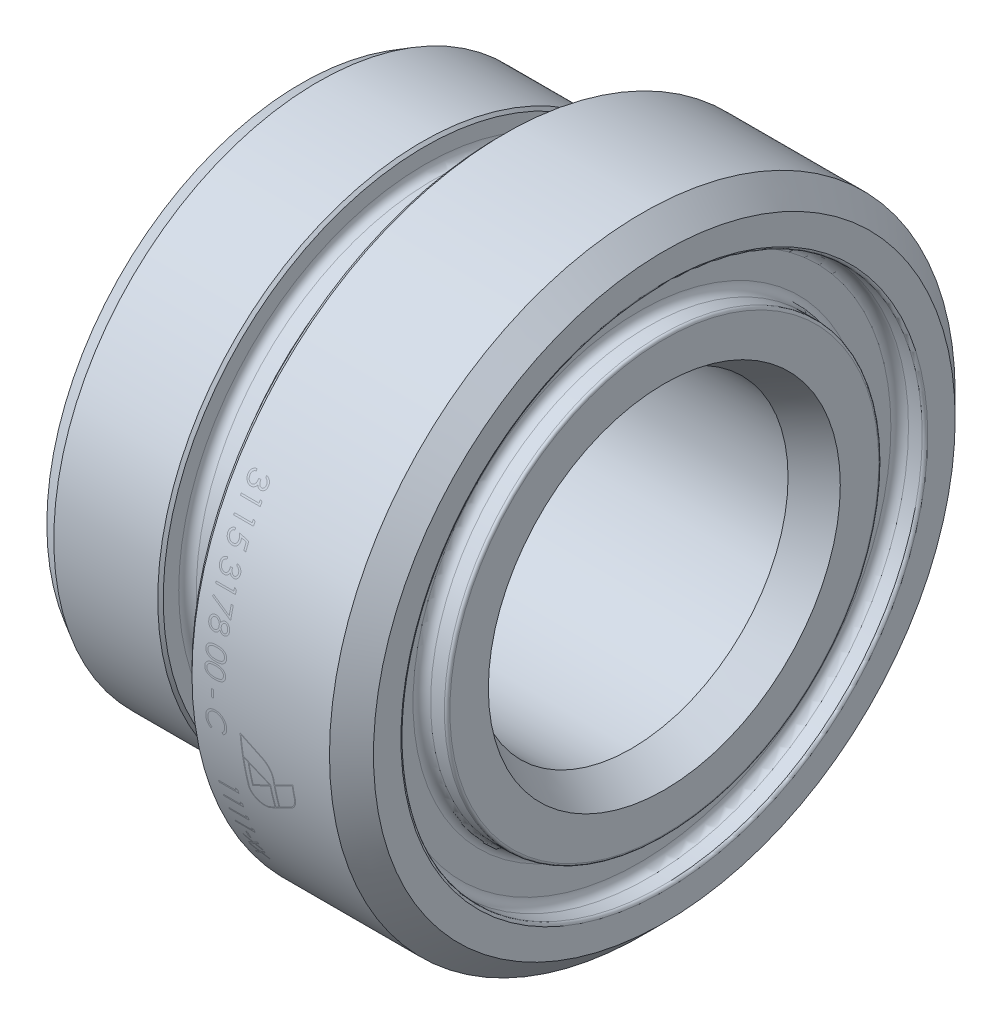
from build123d import *

# Parameters (mm, degrees)
CHAMFER1_SIZE = 0.5
FILLET1_R     = 0.25
FILLET2_R     = 0.25
CHAMFER2_SIZE = 0.25


with BuildPart() as part:
    # Sketch1 → Revolve1 (revolve)
    with BuildSketch(Plane.XY):
        with BuildLine():
            Line((0, 16), (0, 19.75))
            Line((0, 19.75), (-1.5, 19.75))
            ThreePointArc((-1.5, 19.75), (-2.065685425, 19.984314575), (-2.3, 20.55))
            Line((-2.3, 20.55), (-2.3, 22.9))
            ThreePointArc((-2.3, 22.9), (-2.065685425, 23.465685425), (-1.5, 23.7))
            Line((-1.5, 23.7), (0, 23.7))
            Line((0, 23.7), (0, 26.445))
            Line((0, 26.445), (-2, 28.445))
            Line((-2, 28.445), (-15, 28.445))
            Line((-15, 28.445), (-15, 24.46097496))
            ThreePointArc((-15, 24.46097496), (-15.341138851, 23.805653325), (-16.073616115, 23.709220864))
            Line((-16.073616115, 23.709220864), (-16.9, 24.01))
            Line((-16.9, 24.01), (-18, 24.01))
            Line((-18, 24.01), (-18, 22.35))
            ThreePointArc((-18, 22.35), (-18.234314575, 21.784314575), (-18.8, 21.55))
            Line((-18.8, 21.55), (-21, 21.55))
            ThreePointArc((-21, 21.55), (-21.565685425, 21.784314575), (-21.8, 22.35))
            Line((-21.8, 22.35), (-21.8, 24.01))
            Line((-21.8, 24.01), (-31.5, 24.01))
            Line((-31.5, 24.01), (-33, 23.143974596))
            Line((-33, 23.143974596), (-33, 20.025))
            Line((-33, 20.025), (-26.8, 20.025))
            ThreePointArc((-26.8, 20.025), (-26.234314575, 19.790685425), (-26, 19.225))
            Line((-26, 19.225), (-26, 15.275))
            Line((-26, 15.275), (-24.5, 15.275))
            Line((-24.5, 15.275), (-24.5, 14.25))
            Line((-24.5, 14.25), (-3, 14.25))
            Line((-3, 14.25), (0, 16))
        make_face()
    revolve(axis=Axis((0, 0, 0), (-1, 0, 0)))

    # Chamfer1
    chamfer1_edges = [part.edges().sort_by_distance(p)[0] for p in [
        (-15, -28.445, 0),
    ]]
    chamfer(chamfer1_edges, length=CHAMFER1_SIZE)

    # Fillet1
    fillet1_edges = [part.edges().sort_by_distance(p)[0] for p in [
        (-24.5, -14.25, 0),
    ]]
    fillet(fillet1_edges, radius=FILLET1_R)

    # Fillet2
    fillet2_edges = [part.edges().sort_by_distance(p)[0] for p in [
        (0, -19.75, 0),
        (0, -23.7, 0),
    ]]
    fillet(fillet2_edges, radius=FILLET2_R)

    # Chamfer2
    chamfer2_edges = [part.edges().sort_by_distance(p)[0] for p in [
        (-18, -24.01, 0),
        (-21.8, -24.01, 0),
        (-33, -20.025, 0),
    ]]
    chamfer(chamfer2_edges, length=CHAMFER2_SIZE)


solid = part.part
